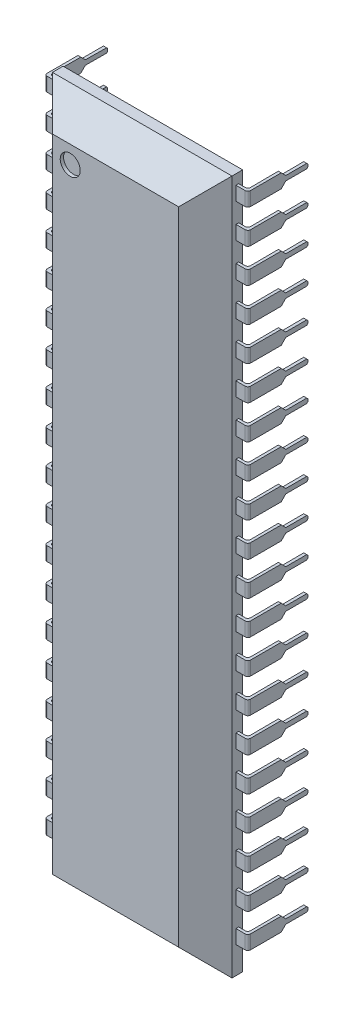
from build123d import *

# Parameters (mm, degrees)
SKETCH_1_W              = 13.462
SKETCH_1_H              = 52.07
EXTRUDE_1_DEPTH         = 4.8
CHAMFER_1_SIZE          = 2
SKETCH_2_R              = 0.75
CUT_EXTRUDE_21335_DEPTH = 0.25
EXTRUDE_4_DEPTH         = 0.5205
CUT_EXTRUDE_2_REACH     = 32.113
PATTERN_LINEAR_1_COUNT  = 20
PATTERN_LINEAR_1_PITCH  = 2.54
MIRROR_3_COPY_1_DEPTH   = 0.5205
MIRROR_3_COPY_2_DEPTH   = 0.5205
MIRROR_3_COPY_3_DEPTH   = 0.5205
MIRROR_3_COPY_4_DEPTH   = 0.5205
MIRROR_3_COPY_5_DEPTH   = 0.5205
MIRROR_3_COPY_6_DEPTH   = 0.5205
MIRROR_3_COPY_7_DEPTH   = 0.5205
MIRROR_3_COPY_8_DEPTH   = 0.5205
MIRROR_3_COPY_9_DEPTH   = 0.5205
MIRROR_3_COPY_10_DEPTH  = 0.5205
MIRROR_3_COPY_11_DEPTH  = 0.5205
MIRROR_3_COPY_12_DEPTH  = 0.5205
MIRROR_3_COPY_13_DEPTH  = 0.5205
MIRROR_3_COPY_14_DEPTH  = 0.5205
MIRROR_3_COPY_15_DEPTH  = 0.5205
MIRROR_3_COPY_16_DEPTH  = 0.5205
MIRROR_3_COPY_17_DEPTH  = 0.5205
MIRROR_3_COPY_18_DEPTH  = 0.5205
MIRROR_3_COPY_19_DEPTH  = 0.5205
MIRROR_3_COPY_20_REACH  = 32.113
MIRROR_3_COPY_21_REACH  = 32.113
MIRROR_3_COPY_22_REACH  = 32.113
MIRROR_3_COPY_23_REACH  = 32.113
MIRROR_3_COPY_24_REACH  = 32.113
MIRROR_3_COPY_25_REACH  = 32.113
MIRROR_3_COPY_26_REACH  = 32.113
MIRROR_3_COPY_27_REACH  = 32.113
MIRROR_3_COPY_28_REACH  = 32.113
MIRROR_3_COPY_29_REACH  = 32.113
MIRROR_3_COPY_30_REACH  = 32.113
MIRROR_3_COPY_31_REACH  = 32.113
MIRROR_3_COPY_32_REACH  = 32.113
MIRROR_3_COPY_33_REACH  = 32.113
MIRROR_3_COPY_34_REACH  = 32.113
MIRROR_3_COPY_35_REACH  = 32.113
MIRROR_3_COPY_36_REACH  = 32.113
MIRROR_3_COPY_37_REACH  = 32.113
MIRROR_3_COPY_38_REACH  = 32.113


with BuildPart() as part:
    # 草图1 → 凸台-拉伸1 (new body)
    with BuildSketch(Plane.XY):
        Rectangle(SKETCH_1_W, SKETCH_1_H)
    extrude(amount=EXTRUDE_1_DEPTH)

    # 倒角1
    chamfer_1_edges = [part.edges().sort_by_distance(p)[0] for p in [
        (6.731, 0, 0),
        (0, 26.035, 0),
        (-6.731, 0, 0),
        (0, -26.035, 0),
        (0, 26.035, 4.8),
        (-6.731, 0, 4.8),
        (0, -26.035, 4.8),
        (6.731, 0, 4.8),
    ]]
    chamfer(chamfer_1_edges, length=CHAMFER_1_SIZE)

    # 草图2 → Cut-Extrude 21335 (cut)
    with BuildSketch(Plane.XY.offset(4.8)):
        with Locations((-3.396305551, 22.700305551)):
            Circle(SKETCH_2_R)
    extrude(amount=-CUT_EXTRUDE_21335_DEPTH, mode=Mode.SUBTRACT)

    # 草图3 → 引脚4 (add, symmetric)
    with BuildSketch(Plane.XZ.offset(23.495)):
        with BuildLine():
            Line((7.62, 2.2985), (7.62, 2.3015))
            ThreePointArc((7.62, 2.3015), (7.561421356, 2.442921356), (7.42, 2.5015))
            Line((7.42, 2.5015), (6.731, 2.5015))
            Line((6.731, 2.5015), (6.731, 2.2985))
            Line((6.731, 2.2985), (7.217, 2.2985))
            ThreePointArc((7.217, 2.2985), (7.358421356, 2.239921356), (7.417, 2.0985))
            Line((7.417, 2.0985), (7.417, 1.85633477))
            Line((7.417, 1.85633477), (7.391011887, -2))
            Line((7.391011887, -2), (7.62, -2))
            Line((7.62, -2), (7.62, 2.2985))
        make_face()
    extrude_4 = extrude(amount=EXTRUDE_4_DEPTH, both=True)

    # 草图4 → 引脚2 (cut, up to next)
    with BuildSketch(Plane(origin=(7.62, 0, 0), x_dir=(0, 0, -1), z_dir=(1, 0, 0)), mode=Mode.PRIVATE) as cut_extrude_2_sk1:
        Polygon((0, -22.9745), (0.3425, -23.317), (1.915533025, -23.317), (2, -23.401466975), (2, -23.317), (2, -22.9745), align=None)
    cut_extrude_2_tool1 = extrude(cut_extrude_2_sk1.sketch, amount=-CUT_EXTRUDE_2_REACH, mode=Mode.PRIVATE) & part.part
    # 草图4 → 引脚2 (cut, up to next)
    with BuildSketch(Plane(origin=(7.62, 0, 0), x_dir=(0, 0, -1), z_dir=(1, 0, 0)), mode=Mode.PRIVATE) as cut_extrude_2_sk2:
        Polygon((1.915533025, -23.673), (0.3425, -23.673), (0, -24.0155), (2, -24.0155), (2, -23.673), (2, -23.588533025), align=None)
    cut_extrude_2_tool2 = extrude(cut_extrude_2_sk2.sketch, amount=-CUT_EXTRUDE_2_REACH, mode=Mode.PRIVATE) & part.part
    cut_extrude_2_1 = cut_extrude_2_tool1.solids().sort_by_distance((7.62, -23.141564, -1.087986))[0]
    add(cut_extrude_2_1, mode=Mode.SUBTRACT)
    cut_extrude_2_2 = cut_extrude_2_tool2.solids().sort_by_distance((7.62, -23.848436, -1.087986))[0]
    add(cut_extrude_2_2, mode=Mode.SUBTRACT)
    cut_extrude_2 = cut_extrude_2_1 + cut_extrude_2_2  # 引脚2 as one shape, for the pattern or mirror that repeats it

    # 引脚1: 引脚4, 引脚2 ×20
    with Locations(*[(0, i * PATTERN_LINEAR_1_PITCH, 0) for i in range(1, PATTERN_LINEAR_1_COUNT)]):
        add(extrude_4)
        add(cut_extrude_2, mode=Mode.SUBTRACT)

    # 引脚3: 引脚4, 引脚2 across plane
    add(extrude_4.mirror(Plane(origin=(0, 0, 0), x_dir=(0, 0, 1), z_dir=(1, 0, 0))))
    add(cut_extrude_2.mirror(Plane(origin=(0, 0, 0), x_dir=(0, 0, 1), z_dir=(1, 0, 0))), mode=Mode.SUBTRACT)

    # 引脚3 copy 1 sketch → 引脚3 copy 1 (add, symmetric)
    with BuildSketch(Plane(origin=(0, -20.955, 0), x_dir=(-1, 0, 0), z_dir=(0, -1, 0))):
        with BuildLine():
            Line((7.62, -2.2985), (7.62, -2.3015))
            ThreePointArc((7.62, -2.3015), (7.561421356, -2.442921356), (7.42, -2.5015))
            Line((7.42, -2.5015), (6.731, -2.5015))
            Line((6.731, -2.5015), (6.731, -2.2985))
            Line((6.731, -2.2985), (7.217, -2.2985))
            ThreePointArc((7.217, -2.2985), (7.358421356, -2.239921356), (7.417, -2.0985))
            Line((7.417, -2.0985), (7.417, -1.85633477))
            Line((7.417, -1.85633477), (7.391011887, 2))
            Line((7.391011887, 2), (7.62, 2))
            Line((7.62, 2), (7.62, -2.2985))
        make_face()
    extrude(amount=MIRROR_3_COPY_1_DEPTH, both=True)

    # 引脚3 copy 2 sketch → 引脚3 copy 2 (add, symmetric)
    with BuildSketch(Plane(origin=(0, -18.415, 0), x_dir=(-1, 0, 0), z_dir=(0, -1, 0))):
        with BuildLine():
            Line((7.62, -2.2985), (7.62, -2.3015))
            ThreePointArc((7.62, -2.3015), (7.561421356, -2.442921356), (7.42, -2.5015))
            Line((7.42, -2.5015), (6.731, -2.5015))
            Line((6.731, -2.5015), (6.731, -2.2985))
            Line((6.731, -2.2985), (7.217, -2.2985))
            ThreePointArc((7.217, -2.2985), (7.358421356, -2.239921356), (7.417, -2.0985))
            Line((7.417, -2.0985), (7.417, -1.85633477))
            Line((7.417, -1.85633477), (7.391011887, 2))
            Line((7.391011887, 2), (7.62, 2))
            Line((7.62, 2), (7.62, -2.2985))
        make_face()
    extrude(amount=MIRROR_3_COPY_2_DEPTH, both=True)

    # 引脚3 copy 3 sketch → 引脚3 copy 3 (add, symmetric)
    with BuildSketch(Plane(origin=(0, -15.875, 0), x_dir=(-1, 0, 0), z_dir=(0, -1, 0))):
        with BuildLine():
            Line((7.62, -2.2985), (7.62, -2.3015))
            ThreePointArc((7.62, -2.3015), (7.561421356, -2.442921356), (7.42, -2.5015))
            Line((7.42, -2.5015), (6.731, -2.5015))
            Line((6.731, -2.5015), (6.731, -2.2985))
            Line((6.731, -2.2985), (7.217, -2.2985))
            ThreePointArc((7.217, -2.2985), (7.358421356, -2.239921356), (7.417, -2.0985))
            Line((7.417, -2.0985), (7.417, -1.85633477))
            Line((7.417, -1.85633477), (7.391011887, 2))
            Line((7.391011887, 2), (7.62, 2))
            Line((7.62, 2), (7.62, -2.2985))
        make_face()
    extrude(amount=MIRROR_3_COPY_3_DEPTH, both=True)

    # 引脚3 copy 4 sketch → 引脚3 copy 4 (add, symmetric)
    with BuildSketch(Plane(origin=(0, -13.335, 0), x_dir=(-1, 0, 0), z_dir=(0, -1, 0))):
        with BuildLine():
            Line((7.62, -2.2985), (7.62, -2.3015))
            ThreePointArc((7.62, -2.3015), (7.561421356, -2.442921356), (7.42, -2.5015))
            Line((7.42, -2.5015), (6.731, -2.5015))
            Line((6.731, -2.5015), (6.731, -2.2985))
            Line((6.731, -2.2985), (7.217, -2.2985))
            ThreePointArc((7.217, -2.2985), (7.358421356, -2.239921356), (7.417, -2.0985))
            Line((7.417, -2.0985), (7.417, -1.85633477))
            Line((7.417, -1.85633477), (7.391011887, 2))
            Line((7.391011887, 2), (7.62, 2))
            Line((7.62, 2), (7.62, -2.2985))
        make_face()
    extrude(amount=MIRROR_3_COPY_4_DEPTH, both=True)

    # 引脚3 copy 5 sketch → 引脚3 copy 5 (add, symmetric)
    with BuildSketch(Plane(origin=(0, -10.795, 0), x_dir=(-1, 0, 0), z_dir=(0, -1, 0))):
        with BuildLine():
            Line((7.62, -2.2985), (7.62, -2.3015))
            ThreePointArc((7.62, -2.3015), (7.561421356, -2.442921356), (7.42, -2.5015))
            Line((7.42, -2.5015), (6.731, -2.5015))
            Line((6.731, -2.5015), (6.731, -2.2985))
            Line((6.731, -2.2985), (7.217, -2.2985))
            ThreePointArc((7.217, -2.2985), (7.358421356, -2.239921356), (7.417, -2.0985))
            Line((7.417, -2.0985), (7.417, -1.85633477))
            Line((7.417, -1.85633477), (7.391011887, 2))
            Line((7.391011887, 2), (7.62, 2))
            Line((7.62, 2), (7.62, -2.2985))
        make_face()
    extrude(amount=MIRROR_3_COPY_5_DEPTH, both=True)

    # 引脚3 copy 6 sketch → 引脚3 copy 6 (add, symmetric)
    with BuildSketch(Plane(origin=(0, -8.255, 0), x_dir=(-1, 0, 0), z_dir=(0, -1, 0))):
        with BuildLine():
            Line((7.62, -2.2985), (7.62, -2.3015))
            ThreePointArc((7.62, -2.3015), (7.561421356, -2.442921356), (7.42, -2.5015))
            Line((7.42, -2.5015), (6.731, -2.5015))
            Line((6.731, -2.5015), (6.731, -2.2985))
            Line((6.731, -2.2985), (7.217, -2.2985))
            ThreePointArc((7.217, -2.2985), (7.358421356, -2.239921356), (7.417, -2.0985))
            Line((7.417, -2.0985), (7.417, -1.85633477))
            Line((7.417, -1.85633477), (7.391011887, 2))
            Line((7.391011887, 2), (7.62, 2))
            Line((7.62, 2), (7.62, -2.2985))
        make_face()
    extrude(amount=MIRROR_3_COPY_6_DEPTH, both=True)

    # 引脚3 copy 7 sketch → 引脚3 copy 7 (add, symmetric)
    with BuildSketch(Plane(origin=(0, -5.715, 0), x_dir=(-1, 0, 0), z_dir=(0, -1, 0))):
        with BuildLine():
            Line((7.62, -2.2985), (7.62, -2.3015))
            ThreePointArc((7.62, -2.3015), (7.561421356, -2.442921356), (7.42, -2.5015))
            Line((7.42, -2.5015), (6.731, -2.5015))
            Line((6.731, -2.5015), (6.731, -2.2985))
            Line((6.731, -2.2985), (7.217, -2.2985))
            ThreePointArc((7.217, -2.2985), (7.358421356, -2.239921356), (7.417, -2.0985))
            Line((7.417, -2.0985), (7.417, -1.85633477))
            Line((7.417, -1.85633477), (7.391011887, 2))
            Line((7.391011887, 2), (7.62, 2))
            Line((7.62, 2), (7.62, -2.2985))
        make_face()
    extrude(amount=MIRROR_3_COPY_7_DEPTH, both=True)

    # 引脚3 copy 8 sketch → 引脚3 copy 8 (add, symmetric)
    with BuildSketch(Plane(origin=(0, -3.175, 0), x_dir=(-1, 0, 0), z_dir=(0, -1, 0))):
        with BuildLine():
            Line((7.62, -2.2985), (7.62, -2.3015))
            ThreePointArc((7.62, -2.3015), (7.561421356, -2.442921356), (7.42, -2.5015))
            Line((7.42, -2.5015), (6.731, -2.5015))
            Line((6.731, -2.5015), (6.731, -2.2985))
            Line((6.731, -2.2985), (7.217, -2.2985))
            ThreePointArc((7.217, -2.2985), (7.358421356, -2.239921356), (7.417, -2.0985))
            Line((7.417, -2.0985), (7.417, -1.85633477))
            Line((7.417, -1.85633477), (7.391011887, 2))
            Line((7.391011887, 2), (7.62, 2))
            Line((7.62, 2), (7.62, -2.2985))
        make_face()
    extrude(amount=MIRROR_3_COPY_8_DEPTH, both=True)

    # 引脚3 copy 9 sketch → 引脚3 copy 9 (add, symmetric)
    with BuildSketch(Plane(origin=(0, -0.635, 0), x_dir=(-1, 0, 0), z_dir=(0, -1, 0))):
        with BuildLine():
            Line((7.62, -2.2985), (7.62, -2.3015))
            ThreePointArc((7.62, -2.3015), (7.561421356, -2.442921356), (7.42, -2.5015))
            Line((7.42, -2.5015), (6.731, -2.5015))
            Line((6.731, -2.5015), (6.731, -2.2985))
            Line((6.731, -2.2985), (7.217, -2.2985))
            ThreePointArc((7.217, -2.2985), (7.358421356, -2.239921356), (7.417, -2.0985))
            Line((7.417, -2.0985), (7.417, -1.85633477))
            Line((7.417, -1.85633477), (7.391011887, 2))
            Line((7.391011887, 2), (7.62, 2))
            Line((7.62, 2), (7.62, -2.2985))
        make_face()
    extrude(amount=MIRROR_3_COPY_9_DEPTH, both=True)

    # 引脚3 copy 10 sketch → 引脚3 copy 10 (add, symmetric)
    with BuildSketch(Plane(origin=(0, 1.905, 0), x_dir=(-1, 0, 0), z_dir=(0, -1, 0))):
        with BuildLine():
            Line((7.62, -2.2985), (7.62, -2.3015))
            ThreePointArc((7.62, -2.3015), (7.561421356, -2.442921356), (7.42, -2.5015))
            Line((7.42, -2.5015), (6.731, -2.5015))
            Line((6.731, -2.5015), (6.731, -2.2985))
            Line((6.731, -2.2985), (7.217, -2.2985))
            ThreePointArc((7.217, -2.2985), (7.358421356, -2.239921356), (7.417, -2.0985))
            Line((7.417, -2.0985), (7.417, -1.85633477))
            Line((7.417, -1.85633477), (7.391011887, 2))
            Line((7.391011887, 2), (7.62, 2))
            Line((7.62, 2), (7.62, -2.2985))
        make_face()
    extrude(amount=MIRROR_3_COPY_10_DEPTH, both=True)

    # 引脚3 copy 11 sketch → 引脚3 copy 11 (add, symmetric)
    with BuildSketch(Plane(origin=(0, 4.445, 0), x_dir=(-1, 0, 0), z_dir=(0, -1, 0))):
        with BuildLine():
            Line((7.62, -2.2985), (7.62, -2.3015))
            ThreePointArc((7.62, -2.3015), (7.561421356, -2.442921356), (7.42, -2.5015))
            Line((7.42, -2.5015), (6.731, -2.5015))
            Line((6.731, -2.5015), (6.731, -2.2985))
            Line((6.731, -2.2985), (7.217, -2.2985))
            ThreePointArc((7.217, -2.2985), (7.358421356, -2.239921356), (7.417, -2.0985))
            Line((7.417, -2.0985), (7.417, -1.85633477))
            Line((7.417, -1.85633477), (7.391011887, 2))
            Line((7.391011887, 2), (7.62, 2))
            Line((7.62, 2), (7.62, -2.2985))
        make_face()
    extrude(amount=MIRROR_3_COPY_11_DEPTH, both=True)

    # 引脚3 copy 12 sketch → 引脚3 copy 12 (add, symmetric)
    with BuildSketch(Plane(origin=(0, 6.985, 0), x_dir=(-1, 0, 0), z_dir=(0, -1, 0))):
        with BuildLine():
            Line((7.62, -2.2985), (7.62, -2.3015))
            ThreePointArc((7.62, -2.3015), (7.561421356, -2.442921356), (7.42, -2.5015))
            Line((7.42, -2.5015), (6.731, -2.5015))
            Line((6.731, -2.5015), (6.731, -2.2985))
            Line((6.731, -2.2985), (7.217, -2.2985))
            ThreePointArc((7.217, -2.2985), (7.358421356, -2.239921356), (7.417, -2.0985))
            Line((7.417, -2.0985), (7.417, -1.85633477))
            Line((7.417, -1.85633477), (7.391011887, 2))
            Line((7.391011887, 2), (7.62, 2))
            Line((7.62, 2), (7.62, -2.2985))
        make_face()
    extrude(amount=MIRROR_3_COPY_12_DEPTH, both=True)

    # 引脚3 copy 13 sketch → 引脚3 copy 13 (add, symmetric)
    with BuildSketch(Plane(origin=(0, 9.525, 0), x_dir=(-1, 0, 0), z_dir=(0, -1, 0))):
        with BuildLine():
            Line((7.62, -2.2985), (7.62, -2.3015))
            ThreePointArc((7.62, -2.3015), (7.561421356, -2.442921356), (7.42, -2.5015))
            Line((7.42, -2.5015), (6.731, -2.5015))
            Line((6.731, -2.5015), (6.731, -2.2985))
            Line((6.731, -2.2985), (7.217, -2.2985))
            ThreePointArc((7.217, -2.2985), (7.358421356, -2.239921356), (7.417, -2.0985))
            Line((7.417, -2.0985), (7.417, -1.85633477))
            Line((7.417, -1.85633477), (7.391011887, 2))
            Line((7.391011887, 2), (7.62, 2))
            Line((7.62, 2), (7.62, -2.2985))
        make_face()
    extrude(amount=MIRROR_3_COPY_13_DEPTH, both=True)

    # 引脚3 copy 14 sketch → 引脚3 copy 14 (add, symmetric)
    with BuildSketch(Plane(origin=(0, 12.065, 0), x_dir=(-1, 0, 0), z_dir=(0, -1, 0))):
        with BuildLine():
            Line((7.62, -2.2985), (7.62, -2.3015))
            ThreePointArc((7.62, -2.3015), (7.561421356, -2.442921356), (7.42, -2.5015))
            Line((7.42, -2.5015), (6.731, -2.5015))
            Line((6.731, -2.5015), (6.731, -2.2985))
            Line((6.731, -2.2985), (7.217, -2.2985))
            ThreePointArc((7.217, -2.2985), (7.358421356, -2.239921356), (7.417, -2.0985))
            Line((7.417, -2.0985), (7.417, -1.85633477))
            Line((7.417, -1.85633477), (7.391011887, 2))
            Line((7.391011887, 2), (7.62, 2))
            Line((7.62, 2), (7.62, -2.2985))
        make_face()
    extrude(amount=MIRROR_3_COPY_14_DEPTH, both=True)

    # 引脚3 copy 15 sketch → 引脚3 copy 15 (add, symmetric)
    with BuildSketch(Plane(origin=(0, 14.605, 0), x_dir=(-1, 0, 0), z_dir=(0, -1, 0))):
        with BuildLine():
            Line((7.62, -2.2985), (7.62, -2.3015))
            ThreePointArc((7.62, -2.3015), (7.561421356, -2.442921356), (7.42, -2.5015))
            Line((7.42, -2.5015), (6.731, -2.5015))
            Line((6.731, -2.5015), (6.731, -2.2985))
            Line((6.731, -2.2985), (7.217, -2.2985))
            ThreePointArc((7.217, -2.2985), (7.358421356, -2.239921356), (7.417, -2.0985))
            Line((7.417, -2.0985), (7.417, -1.85633477))
            Line((7.417, -1.85633477), (7.391011887, 2))
            Line((7.391011887, 2), (7.62, 2))
            Line((7.62, 2), (7.62, -2.2985))
        make_face()
    extrude(amount=MIRROR_3_COPY_15_DEPTH, both=True)

    # 引脚3 copy 16 sketch → 引脚3 copy 16 (add, symmetric)
    with BuildSketch(Plane(origin=(0, 17.145, 0), x_dir=(-1, 0, 0), z_dir=(0, -1, 0))):
        with BuildLine():
            Line((7.62, -2.2985), (7.62, -2.3015))
            ThreePointArc((7.62, -2.3015), (7.561421356, -2.442921356), (7.42, -2.5015))
            Line((7.42, -2.5015), (6.731, -2.5015))
            Line((6.731, -2.5015), (6.731, -2.2985))
            Line((6.731, -2.2985), (7.217, -2.2985))
            ThreePointArc((7.217, -2.2985), (7.358421356, -2.239921356), (7.417, -2.0985))
            Line((7.417, -2.0985), (7.417, -1.85633477))
            Line((7.417, -1.85633477), (7.391011887, 2))
            Line((7.391011887, 2), (7.62, 2))
            Line((7.62, 2), (7.62, -2.2985))
        make_face()
    extrude(amount=MIRROR_3_COPY_16_DEPTH, both=True)

    # 引脚3 copy 17 sketch → 引脚3 copy 17 (add, symmetric)
    with BuildSketch(Plane(origin=(0, 19.685, 0), x_dir=(-1, 0, 0), z_dir=(0, -1, 0))):
        with BuildLine():
            Line((7.62, -2.2985), (7.62, -2.3015))
            ThreePointArc((7.62, -2.3015), (7.561421356, -2.442921356), (7.42, -2.5015))
            Line((7.42, -2.5015), (6.731, -2.5015))
            Line((6.731, -2.5015), (6.731, -2.2985))
            Line((6.731, -2.2985), (7.217, -2.2985))
            ThreePointArc((7.217, -2.2985), (7.358421356, -2.239921356), (7.417, -2.0985))
            Line((7.417, -2.0985), (7.417, -1.85633477))
            Line((7.417, -1.85633477), (7.391011887, 2))
            Line((7.391011887, 2), (7.62, 2))
            Line((7.62, 2), (7.62, -2.2985))
        make_face()
    extrude(amount=MIRROR_3_COPY_17_DEPTH, both=True)

    # 引脚3 copy 18 sketch → 引脚3 copy 18 (add, symmetric)
    with BuildSketch(Plane(origin=(0, 22.225, 0), x_dir=(-1, 0, 0), z_dir=(0, -1, 0))):
        with BuildLine():
            Line((7.62, -2.2985), (7.62, -2.3015))
            ThreePointArc((7.62, -2.3015), (7.561421356, -2.442921356), (7.42, -2.5015))
            Line((7.42, -2.5015), (6.731, -2.5015))
            Line((6.731, -2.5015), (6.731, -2.2985))
            Line((6.731, -2.2985), (7.217, -2.2985))
            ThreePointArc((7.217, -2.2985), (7.358421356, -2.239921356), (7.417, -2.0985))
            Line((7.417, -2.0985), (7.417, -1.85633477))
            Line((7.417, -1.85633477), (7.391011887, 2))
            Line((7.391011887, 2), (7.62, 2))
            Line((7.62, 2), (7.62, -2.2985))
        make_face()
    extrude(amount=MIRROR_3_COPY_18_DEPTH, both=True)

    # 引脚3 copy 19 sketch → 引脚3 copy 19 (add, symmetric)
    with BuildSketch(Plane(origin=(0, 24.765, 0), x_dir=(-1, 0, 0), z_dir=(0, -1, 0))):
        with BuildLine():
            Line((7.62, -2.2985), (7.62, -2.3015))
            ThreePointArc((7.62, -2.3015), (7.561421356, -2.442921356), (7.42, -2.5015))
            Line((7.42, -2.5015), (6.731, -2.5015))
            Line((6.731, -2.5015), (6.731, -2.2985))
            Line((6.731, -2.2985), (7.217, -2.2985))
            ThreePointArc((7.217, -2.2985), (7.358421356, -2.239921356), (7.417, -2.0985))
            Line((7.417, -2.0985), (7.417, -1.85633477))
            Line((7.417, -1.85633477), (7.391011887, 2))
            Line((7.391011887, 2), (7.62, 2))
            Line((7.62, 2), (7.62, -2.2985))
        make_face()
    extrude(amount=MIRROR_3_COPY_19_DEPTH, both=True)

    # 引脚3 copy 20 sketch → 引脚3 copy 20 (cut, up to next)
    with BuildSketch(Plane(origin=(-7.62, 2.54, 0), x_dir=(0, 0, -1), z_dir=(-1, 0, 0)), mode=Mode.PRIVATE) as mirror_3_copy_20_sk1:
        Polygon((0, 22.9745), (0.3425, 23.317), (1.915533025, 23.317), (2, 23.401466975), (2, 23.317), (2, 22.9745), align=None)
    mirror_3_copy_20_tool1 = extrude(mirror_3_copy_20_sk1.sketch, amount=-MIRROR_3_COPY_20_REACH, mode=Mode.PRIVATE) & part.part
    # 引脚3 copy 20 sketch → 引脚3 copy 20 (cut, up to next)
    with BuildSketch(Plane(origin=(-7.62, 2.54, 0), x_dir=(0, 0, -1), z_dir=(-1, 0, 0)), mode=Mode.PRIVATE) as mirror_3_copy_20_sk2:
        Polygon((1.915533025, 23.673), (0.3425, 23.673), (0, 24.0155), (2, 24.0155), (2, 23.673), (2, 23.588533025), align=None)
    mirror_3_copy_20_tool2 = extrude(mirror_3_copy_20_sk2.sketch, amount=-MIRROR_3_COPY_20_REACH, mode=Mode.PRIVATE) & part.part
    add(mirror_3_copy_20_tool1.solids().sort_by_distance((-7.62, -20.601564, -1.087986))[0], mode=Mode.SUBTRACT)
    add(mirror_3_copy_20_tool2.solids().sort_by_distance((-7.62, -21.308436, -1.087986))[0], mode=Mode.SUBTRACT)

    # 引脚3 copy 21 sketch → 引脚3 copy 21 (cut, up to next)
    with BuildSketch(Plane(origin=(-7.62, 5.08, 0), x_dir=(0, 0, -1), z_dir=(-1, 0, 0)), mode=Mode.PRIVATE) as mirror_3_copy_21_sk1:
        Polygon((0, 22.9745), (0.3425, 23.317), (1.915533025, 23.317), (2, 23.401466975), (2, 23.317), (2, 22.9745), align=None)
    mirror_3_copy_21_tool1 = extrude(mirror_3_copy_21_sk1.sketch, amount=-MIRROR_3_COPY_21_REACH, mode=Mode.PRIVATE) & part.part
    # 引脚3 copy 21 sketch → 引脚3 copy 21 (cut, up to next)
    with BuildSketch(Plane(origin=(-7.62, 5.08, 0), x_dir=(0, 0, -1), z_dir=(-1, 0, 0)), mode=Mode.PRIVATE) as mirror_3_copy_21_sk2:
        Polygon((1.915533025, 23.673), (0.3425, 23.673), (0, 24.0155), (2, 24.0155), (2, 23.673), (2, 23.588533025), align=None)
    mirror_3_copy_21_tool2 = extrude(mirror_3_copy_21_sk2.sketch, amount=-MIRROR_3_COPY_21_REACH, mode=Mode.PRIVATE) & part.part
    add(mirror_3_copy_21_tool1.solids().sort_by_distance((-7.62, -18.061564, -1.087986))[0], mode=Mode.SUBTRACT)
    add(mirror_3_copy_21_tool2.solids().sort_by_distance((-7.62, -18.768436, -1.087986))[0], mode=Mode.SUBTRACT)

    # 引脚3 copy 22 sketch → 引脚3 copy 22 (cut, up to next)
    with BuildSketch(Plane(origin=(-7.62, 7.62, 0), x_dir=(0, 0, -1), z_dir=(-1, 0, 0)), mode=Mode.PRIVATE) as mirror_3_copy_22_sk1:
        Polygon((0, 22.9745), (0.3425, 23.317), (1.915533025, 23.317), (2, 23.401466975), (2, 23.317), (2, 22.9745), align=None)
    mirror_3_copy_22_tool1 = extrude(mirror_3_copy_22_sk1.sketch, amount=-MIRROR_3_COPY_22_REACH, mode=Mode.PRIVATE) & part.part
    # 引脚3 copy 22 sketch → 引脚3 copy 22 (cut, up to next)
    with BuildSketch(Plane(origin=(-7.62, 7.62, 0), x_dir=(0, 0, -1), z_dir=(-1, 0, 0)), mode=Mode.PRIVATE) as mirror_3_copy_22_sk2:
        Polygon((1.915533025, 23.673), (0.3425, 23.673), (0, 24.0155), (2, 24.0155), (2, 23.673), (2, 23.588533025), align=None)
    mirror_3_copy_22_tool2 = extrude(mirror_3_copy_22_sk2.sketch, amount=-MIRROR_3_COPY_22_REACH, mode=Mode.PRIVATE) & part.part
    add(mirror_3_copy_22_tool1.solids().sort_by_distance((-7.62, -15.521564, -1.087986))[0], mode=Mode.SUBTRACT)
    add(mirror_3_copy_22_tool2.solids().sort_by_distance((-7.62, -16.228436, -1.087986))[0], mode=Mode.SUBTRACT)

    # 引脚3 copy 23 sketch → 引脚3 copy 23 (cut, up to next)
    with BuildSketch(Plane(origin=(-7.62, 10.16, 0), x_dir=(0, 0, -1), z_dir=(-1, 0, 0)), mode=Mode.PRIVATE) as mirror_3_copy_23_sk1:
        Polygon((0, 22.9745), (0.3425, 23.317), (1.915533025, 23.317), (2, 23.401466975), (2, 23.317), (2, 22.9745), align=None)
    mirror_3_copy_23_tool1 = extrude(mirror_3_copy_23_sk1.sketch, amount=-MIRROR_3_COPY_23_REACH, mode=Mode.PRIVATE) & part.part
    # 引脚3 copy 23 sketch → 引脚3 copy 23 (cut, up to next)
    with BuildSketch(Plane(origin=(-7.62, 10.16, 0), x_dir=(0, 0, -1), z_dir=(-1, 0, 0)), mode=Mode.PRIVATE) as mirror_3_copy_23_sk2:
        Polygon((1.915533025, 23.673), (0.3425, 23.673), (0, 24.0155), (2, 24.0155), (2, 23.673), (2, 23.588533025), align=None)
    mirror_3_copy_23_tool2 = extrude(mirror_3_copy_23_sk2.sketch, amount=-MIRROR_3_COPY_23_REACH, mode=Mode.PRIVATE) & part.part
    add(mirror_3_copy_23_tool1.solids().sort_by_distance((-7.62, -12.981564, -1.087986))[0], mode=Mode.SUBTRACT)
    add(mirror_3_copy_23_tool2.solids().sort_by_distance((-7.62, -13.688436, -1.087986))[0], mode=Mode.SUBTRACT)

    # 引脚3 copy 24 sketch → 引脚3 copy 24 (cut, up to next)
    with BuildSketch(Plane(origin=(-7.62, 12.7, 0), x_dir=(0, 0, -1), z_dir=(-1, 0, 0)), mode=Mode.PRIVATE) as mirror_3_copy_24_sk1:
        Polygon((0, 22.9745), (0.3425, 23.317), (1.915533025, 23.317), (2, 23.401466975), (2, 23.317), (2, 22.9745), align=None)
    mirror_3_copy_24_tool1 = extrude(mirror_3_copy_24_sk1.sketch, amount=-MIRROR_3_COPY_24_REACH, mode=Mode.PRIVATE) & part.part
    # 引脚3 copy 24 sketch → 引脚3 copy 24 (cut, up to next)
    with BuildSketch(Plane(origin=(-7.62, 12.7, 0), x_dir=(0, 0, -1), z_dir=(-1, 0, 0)), mode=Mode.PRIVATE) as mirror_3_copy_24_sk2:
        Polygon((1.915533025, 23.673), (0.3425, 23.673), (0, 24.0155), (2, 24.0155), (2, 23.673), (2, 23.588533025), align=None)
    mirror_3_copy_24_tool2 = extrude(mirror_3_copy_24_sk2.sketch, amount=-MIRROR_3_COPY_24_REACH, mode=Mode.PRIVATE) & part.part
    add(mirror_3_copy_24_tool1.solids().sort_by_distance((-7.62, -10.441564, -1.087986))[0], mode=Mode.SUBTRACT)
    add(mirror_3_copy_24_tool2.solids().sort_by_distance((-7.62, -11.148436, -1.087986))[0], mode=Mode.SUBTRACT)

    # 引脚3 copy 25 sketch → 引脚3 copy 25 (cut, up to next)
    with BuildSketch(Plane(origin=(-7.62, 15.24, 0), x_dir=(0, 0, -1), z_dir=(-1, 0, 0)), mode=Mode.PRIVATE) as mirror_3_copy_25_sk1:
        Polygon((0, 22.9745), (0.3425, 23.317), (1.915533025, 23.317), (2, 23.401466975), (2, 23.317), (2, 22.9745), align=None)
    mirror_3_copy_25_tool1 = extrude(mirror_3_copy_25_sk1.sketch, amount=-MIRROR_3_COPY_25_REACH, mode=Mode.PRIVATE) & part.part
    # 引脚3 copy 25 sketch → 引脚3 copy 25 (cut, up to next)
    with BuildSketch(Plane(origin=(-7.62, 15.24, 0), x_dir=(0, 0, -1), z_dir=(-1, 0, 0)), mode=Mode.PRIVATE) as mirror_3_copy_25_sk2:
        Polygon((1.915533025, 23.673), (0.3425, 23.673), (0, 24.0155), (2, 24.0155), (2, 23.673), (2, 23.588533025), align=None)
    mirror_3_copy_25_tool2 = extrude(mirror_3_copy_25_sk2.sketch, amount=-MIRROR_3_COPY_25_REACH, mode=Mode.PRIVATE) & part.part
    add(mirror_3_copy_25_tool1.solids().sort_by_distance((-7.62, -7.901564, -1.087986))[0], mode=Mode.SUBTRACT)
    add(mirror_3_copy_25_tool2.solids().sort_by_distance((-7.62, -8.608436, -1.087986))[0], mode=Mode.SUBTRACT)

    # 引脚3 copy 26 sketch → 引脚3 copy 26 (cut, up to next)
    with BuildSketch(Plane(origin=(-7.62, 17.78, 0), x_dir=(0, 0, -1), z_dir=(-1, 0, 0)), mode=Mode.PRIVATE) as mirror_3_copy_26_sk1:
        Polygon((0, 22.9745), (0.3425, 23.317), (1.915533025, 23.317), (2, 23.401466975), (2, 23.317), (2, 22.9745), align=None)
    mirror_3_copy_26_tool1 = extrude(mirror_3_copy_26_sk1.sketch, amount=-MIRROR_3_COPY_26_REACH, mode=Mode.PRIVATE) & part.part
    # 引脚3 copy 26 sketch → 引脚3 copy 26 (cut, up to next)
    with BuildSketch(Plane(origin=(-7.62, 17.78, 0), x_dir=(0, 0, -1), z_dir=(-1, 0, 0)), mode=Mode.PRIVATE) as mirror_3_copy_26_sk2:
        Polygon((1.915533025, 23.673), (0.3425, 23.673), (0, 24.0155), (2, 24.0155), (2, 23.673), (2, 23.588533025), align=None)
    mirror_3_copy_26_tool2 = extrude(mirror_3_copy_26_sk2.sketch, amount=-MIRROR_3_COPY_26_REACH, mode=Mode.PRIVATE) & part.part
    add(mirror_3_copy_26_tool1.solids().sort_by_distance((-7.62, -5.361564, -1.087986))[0], mode=Mode.SUBTRACT)
    add(mirror_3_copy_26_tool2.solids().sort_by_distance((-7.62, -6.068436, -1.087986))[0], mode=Mode.SUBTRACT)

    # 引脚3 copy 27 sketch → 引脚3 copy 27 (cut, up to next)
    with BuildSketch(Plane(origin=(-7.62, 20.32, 0), x_dir=(0, 0, -1), z_dir=(-1, 0, 0)), mode=Mode.PRIVATE) as mirror_3_copy_27_sk1:
        Polygon((0, 22.9745), (0.3425, 23.317), (1.915533025, 23.317), (2, 23.401466975), (2, 23.317), (2, 22.9745), align=None)
    mirror_3_copy_27_tool1 = extrude(mirror_3_copy_27_sk1.sketch, amount=-MIRROR_3_COPY_27_REACH, mode=Mode.PRIVATE) & part.part
    # 引脚3 copy 27 sketch → 引脚3 copy 27 (cut, up to next)
    with BuildSketch(Plane(origin=(-7.62, 20.32, 0), x_dir=(0, 0, -1), z_dir=(-1, 0, 0)), mode=Mode.PRIVATE) as mirror_3_copy_27_sk2:
        Polygon((1.915533025, 23.673), (0.3425, 23.673), (0, 24.0155), (2, 24.0155), (2, 23.673), (2, 23.588533025), align=None)
    mirror_3_copy_27_tool2 = extrude(mirror_3_copy_27_sk2.sketch, amount=-MIRROR_3_COPY_27_REACH, mode=Mode.PRIVATE) & part.part
    add(mirror_3_copy_27_tool1.solids().sort_by_distance((-7.62, -2.821564, -1.087986))[0], mode=Mode.SUBTRACT)
    add(mirror_3_copy_27_tool2.solids().sort_by_distance((-7.62, -3.528436, -1.087986))[0], mode=Mode.SUBTRACT)

    # 引脚3 copy 28 sketch → 引脚3 copy 28 (cut, up to next)
    with BuildSketch(Plane(origin=(-7.62, 22.86, 0), x_dir=(0, 0, -1), z_dir=(-1, 0, 0)), mode=Mode.PRIVATE) as mirror_3_copy_28_sk1:
        Polygon((0, 22.9745), (0.3425, 23.317), (1.915533025, 23.317), (2, 23.401466975), (2, 23.317), (2, 22.9745), align=None)
    mirror_3_copy_28_tool1 = extrude(mirror_3_copy_28_sk1.sketch, amount=-MIRROR_3_COPY_28_REACH, mode=Mode.PRIVATE) & part.part
    # 引脚3 copy 28 sketch → 引脚3 copy 28 (cut, up to next)
    with BuildSketch(Plane(origin=(-7.62, 22.86, 0), x_dir=(0, 0, -1), z_dir=(-1, 0, 0)), mode=Mode.PRIVATE) as mirror_3_copy_28_sk2:
        Polygon((1.915533025, 23.673), (0.3425, 23.673), (0, 24.0155), (2, 24.0155), (2, 23.673), (2, 23.588533025), align=None)
    mirror_3_copy_28_tool2 = extrude(mirror_3_copy_28_sk2.sketch, amount=-MIRROR_3_COPY_28_REACH, mode=Mode.PRIVATE) & part.part
    add(mirror_3_copy_28_tool1.solids().sort_by_distance((-7.62, -0.281564, -1.087986))[0], mode=Mode.SUBTRACT)
    add(mirror_3_copy_28_tool2.solids().sort_by_distance((-7.62, -0.988436, -1.087986))[0], mode=Mode.SUBTRACT)

    # 引脚3 copy 29 sketch → 引脚3 copy 29 (cut, up to next)
    with BuildSketch(Plane(origin=(-7.62, 25.4, 0), x_dir=(0, 0, -1), z_dir=(-1, 0, 0)), mode=Mode.PRIVATE) as mirror_3_copy_29_sk1:
        Polygon((0, 22.9745), (0.3425, 23.317), (1.915533025, 23.317), (2, 23.401466975), (2, 23.317), (2, 22.9745), align=None)
    mirror_3_copy_29_tool1 = extrude(mirror_3_copy_29_sk1.sketch, amount=-MIRROR_3_COPY_29_REACH, mode=Mode.PRIVATE) & part.part
    # 引脚3 copy 29 sketch → 引脚3 copy 29 (cut, up to next)
    with BuildSketch(Plane(origin=(-7.62, 25.4, 0), x_dir=(0, 0, -1), z_dir=(-1, 0, 0)), mode=Mode.PRIVATE) as mirror_3_copy_29_sk2:
        Polygon((1.915533025, 23.673), (0.3425, 23.673), (0, 24.0155), (2, 24.0155), (2, 23.673), (2, 23.588533025), align=None)
    mirror_3_copy_29_tool2 = extrude(mirror_3_copy_29_sk2.sketch, amount=-MIRROR_3_COPY_29_REACH, mode=Mode.PRIVATE) & part.part
    add(mirror_3_copy_29_tool1.solids().sort_by_distance((-7.62, 2.258436, -1.087986))[0], mode=Mode.SUBTRACT)
    add(mirror_3_copy_29_tool2.solids().sort_by_distance((-7.62, 1.551564, -1.087986))[0], mode=Mode.SUBTRACT)

    # 引脚3 copy 30 sketch → 引脚3 copy 30 (cut, up to next)
    with BuildSketch(Plane(origin=(-7.62, 27.94, 0), x_dir=(0, 0, -1), z_dir=(-1, 0, 0)), mode=Mode.PRIVATE) as mirror_3_copy_30_sk1:
        Polygon((0, 22.9745), (0.3425, 23.317), (1.915533025, 23.317), (2, 23.401466975), (2, 23.317), (2, 22.9745), align=None)
    mirror_3_copy_30_tool1 = extrude(mirror_3_copy_30_sk1.sketch, amount=-MIRROR_3_COPY_30_REACH, mode=Mode.PRIVATE) & part.part
    # 引脚3 copy 30 sketch → 引脚3 copy 30 (cut, up to next)
    with BuildSketch(Plane(origin=(-7.62, 27.94, 0), x_dir=(0, 0, -1), z_dir=(-1, 0, 0)), mode=Mode.PRIVATE) as mirror_3_copy_30_sk2:
        Polygon((1.915533025, 23.673), (0.3425, 23.673), (0, 24.0155), (2, 24.0155), (2, 23.673), (2, 23.588533025), align=None)
    mirror_3_copy_30_tool2 = extrude(mirror_3_copy_30_sk2.sketch, amount=-MIRROR_3_COPY_30_REACH, mode=Mode.PRIVATE) & part.part
    add(mirror_3_copy_30_tool1.solids().sort_by_distance((-7.62, 4.798436, -1.087986))[0], mode=Mode.SUBTRACT)
    add(mirror_3_copy_30_tool2.solids().sort_by_distance((-7.62, 4.091564, -1.087986))[0], mode=Mode.SUBTRACT)

    # 引脚3 copy 31 sketch → 引脚3 copy 31 (cut, up to next)
    with BuildSketch(Plane(origin=(-7.62, 30.48, 0), x_dir=(0, 0, -1), z_dir=(-1, 0, 0)), mode=Mode.PRIVATE) as mirror_3_copy_31_sk1:
        Polygon((0, 22.9745), (0.3425, 23.317), (1.915533025, 23.317), (2, 23.401466975), (2, 23.317), (2, 22.9745), align=None)
    mirror_3_copy_31_tool1 = extrude(mirror_3_copy_31_sk1.sketch, amount=-MIRROR_3_COPY_31_REACH, mode=Mode.PRIVATE) & part.part
    # 引脚3 copy 31 sketch → 引脚3 copy 31 (cut, up to next)
    with BuildSketch(Plane(origin=(-7.62, 30.48, 0), x_dir=(0, 0, -1), z_dir=(-1, 0, 0)), mode=Mode.PRIVATE) as mirror_3_copy_31_sk2:
        Polygon((1.915533025, 23.673), (0.3425, 23.673), (0, 24.0155), (2, 24.0155), (2, 23.673), (2, 23.588533025), align=None)
    mirror_3_copy_31_tool2 = extrude(mirror_3_copy_31_sk2.sketch, amount=-MIRROR_3_COPY_31_REACH, mode=Mode.PRIVATE) & part.part
    add(mirror_3_copy_31_tool1.solids().sort_by_distance((-7.62, 7.338436, -1.087986))[0], mode=Mode.SUBTRACT)
    add(mirror_3_copy_31_tool2.solids().sort_by_distance((-7.62, 6.631564, -1.087986))[0], mode=Mode.SUBTRACT)

    # 引脚3 copy 32 sketch → 引脚3 copy 32 (cut, up to next)
    with BuildSketch(Plane(origin=(-7.62, 33.02, 0), x_dir=(0, 0, -1), z_dir=(-1, 0, 0)), mode=Mode.PRIVATE) as mirror_3_copy_32_sk1:
        Polygon((0, 22.9745), (0.3425, 23.317), (1.915533025, 23.317), (2, 23.401466975), (2, 23.317), (2, 22.9745), align=None)
    mirror_3_copy_32_tool1 = extrude(mirror_3_copy_32_sk1.sketch, amount=-MIRROR_3_COPY_32_REACH, mode=Mode.PRIVATE) & part.part
    # 引脚3 copy 32 sketch → 引脚3 copy 32 (cut, up to next)
    with BuildSketch(Plane(origin=(-7.62, 33.02, 0), x_dir=(0, 0, -1), z_dir=(-1, 0, 0)), mode=Mode.PRIVATE) as mirror_3_copy_32_sk2:
        Polygon((1.915533025, 23.673), (0.3425, 23.673), (0, 24.0155), (2, 24.0155), (2, 23.673), (2, 23.588533025), align=None)
    mirror_3_copy_32_tool2 = extrude(mirror_3_copy_32_sk2.sketch, amount=-MIRROR_3_COPY_32_REACH, mode=Mode.PRIVATE) & part.part
    add(mirror_3_copy_32_tool1.solids().sort_by_distance((-7.62, 9.878436, -1.087986))[0], mode=Mode.SUBTRACT)
    add(mirror_3_copy_32_tool2.solids().sort_by_distance((-7.62, 9.171564, -1.087986))[0], mode=Mode.SUBTRACT)

    # 引脚3 copy 33 sketch → 引脚3 copy 33 (cut, up to next)
    with BuildSketch(Plane(origin=(-7.62, 35.56, 0), x_dir=(0, 0, -1), z_dir=(-1, 0, 0)), mode=Mode.PRIVATE) as mirror_3_copy_33_sk1:
        Polygon((0, 22.9745), (0.3425, 23.317), (1.915533025, 23.317), (2, 23.401466975), (2, 23.317), (2, 22.9745), align=None)
    mirror_3_copy_33_tool1 = extrude(mirror_3_copy_33_sk1.sketch, amount=-MIRROR_3_COPY_33_REACH, mode=Mode.PRIVATE) & part.part
    # 引脚3 copy 33 sketch → 引脚3 copy 33 (cut, up to next)
    with BuildSketch(Plane(origin=(-7.62, 35.56, 0), x_dir=(0, 0, -1), z_dir=(-1, 0, 0)), mode=Mode.PRIVATE) as mirror_3_copy_33_sk2:
        Polygon((1.915533025, 23.673), (0.3425, 23.673), (0, 24.0155), (2, 24.0155), (2, 23.673), (2, 23.588533025), align=None)
    mirror_3_copy_33_tool2 = extrude(mirror_3_copy_33_sk2.sketch, amount=-MIRROR_3_COPY_33_REACH, mode=Mode.PRIVATE) & part.part
    add(mirror_3_copy_33_tool1.solids().sort_by_distance((-7.62, 12.418436, -1.087986))[0], mode=Mode.SUBTRACT)
    add(mirror_3_copy_33_tool2.solids().sort_by_distance((-7.62, 11.711564, -1.087986))[0], mode=Mode.SUBTRACT)

    # 引脚3 copy 34 sketch → 引脚3 copy 34 (cut, up to next)
    with BuildSketch(Plane(origin=(-7.62, 38.1, 0), x_dir=(0, 0, -1), z_dir=(-1, 0, 0)), mode=Mode.PRIVATE) as mirror_3_copy_34_sk1:
        Polygon((0, 22.9745), (0.3425, 23.317), (1.915533025, 23.317), (2, 23.401466975), (2, 23.317), (2, 22.9745), align=None)
    mirror_3_copy_34_tool1 = extrude(mirror_3_copy_34_sk1.sketch, amount=-MIRROR_3_COPY_34_REACH, mode=Mode.PRIVATE) & part.part
    # 引脚3 copy 34 sketch → 引脚3 copy 34 (cut, up to next)
    with BuildSketch(Plane(origin=(-7.62, 38.1, 0), x_dir=(0, 0, -1), z_dir=(-1, 0, 0)), mode=Mode.PRIVATE) as mirror_3_copy_34_sk2:
        Polygon((1.915533025, 23.673), (0.3425, 23.673), (0, 24.0155), (2, 24.0155), (2, 23.673), (2, 23.588533025), align=None)
    mirror_3_copy_34_tool2 = extrude(mirror_3_copy_34_sk2.sketch, amount=-MIRROR_3_COPY_34_REACH, mode=Mode.PRIVATE) & part.part
    add(mirror_3_copy_34_tool1.solids().sort_by_distance((-7.62, 14.958436, -1.087986))[0], mode=Mode.SUBTRACT)
    add(mirror_3_copy_34_tool2.solids().sort_by_distance((-7.62, 14.251564, -1.087986))[0], mode=Mode.SUBTRACT)

    # 引脚3 copy 35 sketch → 引脚3 copy 35 (cut, up to next)
    with BuildSketch(Plane(origin=(-7.62, 40.64, 0), x_dir=(0, 0, -1), z_dir=(-1, 0, 0)), mode=Mode.PRIVATE) as mirror_3_copy_35_sk1:
        Polygon((0, 22.9745), (0.3425, 23.317), (1.915533025, 23.317), (2, 23.401466975), (2, 23.317), (2, 22.9745), align=None)
    mirror_3_copy_35_tool1 = extrude(mirror_3_copy_35_sk1.sketch, amount=-MIRROR_3_COPY_35_REACH, mode=Mode.PRIVATE) & part.part
    # 引脚3 copy 35 sketch → 引脚3 copy 35 (cut, up to next)
    with BuildSketch(Plane(origin=(-7.62, 40.64, 0), x_dir=(0, 0, -1), z_dir=(-1, 0, 0)), mode=Mode.PRIVATE) as mirror_3_copy_35_sk2:
        Polygon((1.915533025, 23.673), (0.3425, 23.673), (0, 24.0155), (2, 24.0155), (2, 23.673), (2, 23.588533025), align=None)
    mirror_3_copy_35_tool2 = extrude(mirror_3_copy_35_sk2.sketch, amount=-MIRROR_3_COPY_35_REACH, mode=Mode.PRIVATE) & part.part
    add(mirror_3_copy_35_tool1.solids().sort_by_distance((-7.62, 17.498436, -1.087986))[0], mode=Mode.SUBTRACT)
    add(mirror_3_copy_35_tool2.solids().sort_by_distance((-7.62, 16.791564, -1.087986))[0], mode=Mode.SUBTRACT)

    # 引脚3 copy 36 sketch → 引脚3 copy 36 (cut, up to next)
    with BuildSketch(Plane(origin=(-7.62, 43.18, 0), x_dir=(0, 0, -1), z_dir=(-1, 0, 0)), mode=Mode.PRIVATE) as mirror_3_copy_36_sk1:
        Polygon((0, 22.9745), (0.3425, 23.317), (1.915533025, 23.317), (2, 23.401466975), (2, 23.317), (2, 22.9745), align=None)
    mirror_3_copy_36_tool1 = extrude(mirror_3_copy_36_sk1.sketch, amount=-MIRROR_3_COPY_36_REACH, mode=Mode.PRIVATE) & part.part
    # 引脚3 copy 36 sketch → 引脚3 copy 36 (cut, up to next)
    with BuildSketch(Plane(origin=(-7.62, 43.18, 0), x_dir=(0, 0, -1), z_dir=(-1, 0, 0)), mode=Mode.PRIVATE) as mirror_3_copy_36_sk2:
        Polygon((1.915533025, 23.673), (0.3425, 23.673), (0, 24.0155), (2, 24.0155), (2, 23.673), (2, 23.588533025), align=None)
    mirror_3_copy_36_tool2 = extrude(mirror_3_copy_36_sk2.sketch, amount=-MIRROR_3_COPY_36_REACH, mode=Mode.PRIVATE) & part.part
    add(mirror_3_copy_36_tool1.solids().sort_by_distance((-7.62, 20.038436, -1.087986))[0], mode=Mode.SUBTRACT)
    add(mirror_3_copy_36_tool2.solids().sort_by_distance((-7.62, 19.331564, -1.087986))[0], mode=Mode.SUBTRACT)

    # 引脚3 copy 37 sketch → 引脚3 copy 37 (cut, up to next)
    with BuildSketch(Plane(origin=(-7.62, 45.72, 0), x_dir=(0, 0, -1), z_dir=(-1, 0, 0)), mode=Mode.PRIVATE) as mirror_3_copy_37_sk1:
        Polygon((0, 22.9745), (0.3425, 23.317), (1.915533025, 23.317), (2, 23.401466975), (2, 23.317), (2, 22.9745), align=None)
    mirror_3_copy_37_tool1 = extrude(mirror_3_copy_37_sk1.sketch, amount=-MIRROR_3_COPY_37_REACH, mode=Mode.PRIVATE) & part.part
    # 引脚3 copy 37 sketch → 引脚3 copy 37 (cut, up to next)
    with BuildSketch(Plane(origin=(-7.62, 45.72, 0), x_dir=(0, 0, -1), z_dir=(-1, 0, 0)), mode=Mode.PRIVATE) as mirror_3_copy_37_sk2:
        Polygon((1.915533025, 23.673), (0.3425, 23.673), (0, 24.0155), (2, 24.0155), (2, 23.673), (2, 23.588533025), align=None)
    mirror_3_copy_37_tool2 = extrude(mirror_3_copy_37_sk2.sketch, amount=-MIRROR_3_COPY_37_REACH, mode=Mode.PRIVATE) & part.part
    add(mirror_3_copy_37_tool1.solids().sort_by_distance((-7.62, 22.578436, -1.087986))[0], mode=Mode.SUBTRACT)
    add(mirror_3_copy_37_tool2.solids().sort_by_distance((-7.62, 21.871564, -1.087986))[0], mode=Mode.SUBTRACT)

    # 引脚3 copy 38 sketch → 引脚3 copy 38 (cut, up to next)
    with BuildSketch(Plane(origin=(-7.62, 48.26, 0), x_dir=(0, 0, -1), z_dir=(-1, 0, 0)), mode=Mode.PRIVATE) as mirror_3_copy_38_sk1:
        Polygon((0, 22.9745), (0.3425, 23.317), (1.915533025, 23.317), (2, 23.401466975), (2, 23.317), (2, 22.9745), align=None)
    mirror_3_copy_38_tool1 = extrude(mirror_3_copy_38_sk1.sketch, amount=-MIRROR_3_COPY_38_REACH, mode=Mode.PRIVATE) & part.part
    # 引脚3 copy 38 sketch → 引脚3 copy 38 (cut, up to next)
    with BuildSketch(Plane(origin=(-7.62, 48.26, 0), x_dir=(0, 0, -1), z_dir=(-1, 0, 0)), mode=Mode.PRIVATE) as mirror_3_copy_38_sk2:
        Polygon((1.915533025, 23.673), (0.3425, 23.673), (0, 24.0155), (2, 24.0155), (2, 23.673), (2, 23.588533025), align=None)
    mirror_3_copy_38_tool2 = extrude(mirror_3_copy_38_sk2.sketch, amount=-MIRROR_3_COPY_38_REACH, mode=Mode.PRIVATE) & part.part
    add(mirror_3_copy_38_tool1.solids().sort_by_distance((-7.62, 25.118436, -1.087986))[0], mode=Mode.SUBTRACT)
    add(mirror_3_copy_38_tool2.solids().sort_by_distance((-7.62, 24.411564, -1.087986))[0], mode=Mode.SUBTRACT)


solid = part.part
